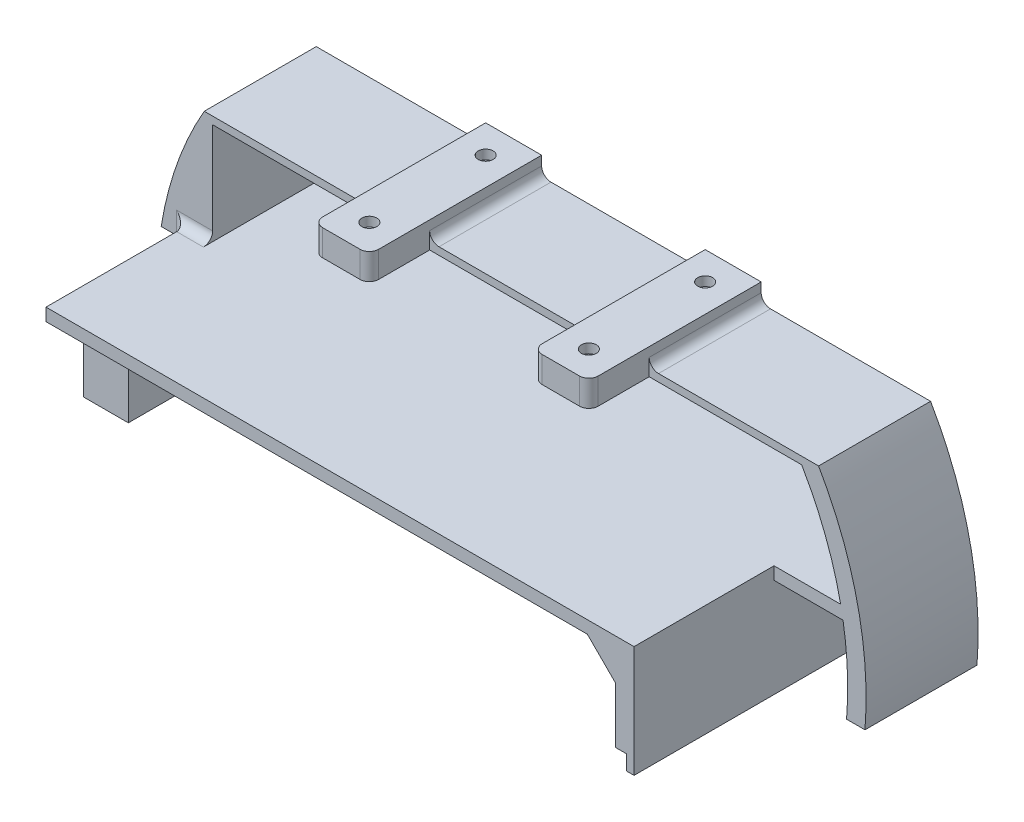
from build123d import *
from build123d.topology import SkipClean

# Parameters (mm, degrees)
BOSS_EXTRUDE1_DEPTH  = 2.54
SKETCH3_W            = 76.962
SKETCH3_H            = 13.7795
CUT_EXTRUDE1_DEPTH   = 55.016072608
BOSS_EXTRUDE2_DEPTH  = 12.7
SKETCH6_W            = 80.01
SKETCH6_H            = 19.05
BOSS_EXTRUDE3_DEPTH  = 1.7145
SKETCH8_W            = 7.62
SKETCH8_H            = 6.35
SKETCH8_W_2          = 2.54
SKETCH8_H_2          = 34.29
BOSS_EXTRUDE4_DEPTH  = 11.43
SKETCH10_W           = 1.016
SKETCH10_H           = 34.29
BOSS_EXTRUDE5_DEPTH  = 2.032
SKETCH13_R           = 0.762
SKETCH13_W           = 7.62
SKETCH13_H           = 23.4442
BOSS_EXTRUDE6_DEPTH  = 2.54
BOSS_EXTRUDE7_START  = -1.016
SKETCH13_2_R         = 0.762
SKETCH13_2_W         = 7.62
SKETCH13_2_H         = 23.4442
BOSS_EXTRUDE7_DEPTH  = 1.016
CUT_EXTRUDE2_REACH   = 68.356
SKETCH13_3_R         = 0.762
SKETCH16_R           = 0.762
CUT_EXTRUDE3_DEPTH   = 8.89
SKETCH17_R           = 1.016
CUT_EXTRUDE4_DEPTH   = 1.27
SKETCH18_R           = 1.016
CUT_EXTRUDE5_DEPTH   = 1.27
BOSS_EXTRUDE8_DEPTH  = 31.75
CUT_EXTRUDE6_REACH   = 104.226
SKETCH20_W           = 15.24
SKETCH20_H           = 2.54
BOSS_EXTRUDE9_DEPTH  = 5.08
BOSS_EXTRUDE10_DEPTH = 12.7
FILLET2_R            = 1.27


with BuildPart() as part:
    # Sketch2 → Boss-Extrude1 (new body)
    with BuildSketch(Plane.XY):
        with BuildLine():
            Line((-41.794385987, 24.13), (41.794385987, 24.13))
            ThreePointArc((41.794385987, 24.13), (47.072627329, 10.639330635), (48.109370189, -3.81))
            Line((48.109370189, -3.81), (-48.109370189, -3.81))
            ThreePointArc((-48.109370189, -3.81), (-47.072627329, 10.639330635), (-41.794385987, 24.13))
        make_face()
    extrude(amount=BOSS_EXTRUDE1_DEPTH)

    # Sketch3 → Cut-Extrude1 (cut, through all)
    with BuildSketch(Plane.XY.offset(2.54)):
        with Locations((-2.164662018, 16.22425)):
            Rectangle(SKETCH3_W, SKETCH3_H)
    extrude(amount=-CUT_EXTRUDE1_DEPTH, mode=Mode.SUBTRACT)

    # Sketch4 → Boss-Extrude2 (add)
    with BuildSketch(Plane.XY.offset(2.54)):
        with BuildLine():
            Line((-22.166164877, 7.62), (47.65462412, 7.62))
            ThreePointArc((47.65462412, 7.62), (45.479955775, 16.143147857), (41.794385987, 24.13))
            Line((41.794385987, 24.13), (-41.794385987, 24.13))
            ThreePointArc((-41.794385987, 24.13), (-45.479955775, 16.143147857), (-47.65462412, 7.62))
            Line((-47.65462412, 7.62), (-22.166164877, 7.62))
        make_face()
        with BuildLine():
            Line((-40.645662018, 23.114), (36.316337982, 23.114))
            Line((36.316337982, 23.114), (39.491337982, 23.114))
            ThreePointArc((39.491337982, 23.114), (42.703177622, 16.439628723), (44.796092255, 9.3345))
            Line((44.796092255, 9.3345), (36.316337982, 9.3345))
            Line((36.316337982, 9.3345), (-40.645662018, 9.3345))
            Line((-40.645662018, 9.3345), (-40.645662018, 23.114))
        make_face(mode=Mode.SUBTRACT)
    extrude(amount=BOSS_EXTRUDE2_DEPTH)

    # Sketch6 → Boss-Extrude3 (add)
    with BuildSketch(Plane.XZ.offset(-7.62)):
        with Locations((-4.27142412, 24.765)):
            Rectangle(SKETCH6_W, SKETCH6_H)
    extrude(amount=-BOSS_EXTRUDE3_DEPTH)

    # Sketch8 → Boss-Extrude4 (add)
    with BuildSketch(Plane.XZ.offset(-7.62)):
        Polygon((-39.45042412, 0), (-39.45042412, 19.05), (-38.18042412, 22.539296323), (-38.18042412, 29.182378244), (-44.27642412, 29.182378244), (-44.27642412, 0), align=None)
        with Locations((3.47557588, 3.175)):
            Rectangle(SKETCH8_W, SKETCH8_H)
        with Locations((34.46357588, 17.145)):
            Rectangle(SKETCH8_W_2, SKETCH8_H_2)
    extrude(amount=BOSS_EXTRUDE4_DEPTH)

    # Sketch10 → Boss-Extrude5 (add)
    with BuildSketch(Plane.XZ.offset(3.81)):
        with Locations((35.22557588, 17.145)):
            Rectangle(SKETCH10_W, SKETCH10_H)
    extrude(amount=BOSS_EXTRUDE5_DEPTH)

    # Sketch13 → Boss-Extrude6 (add)
    # profile 1 of 2: a face of its own
    with BuildSketch(Plane(origin=(0, 24.13, 0), x_dir=(1, 0, 0), z_dir=(0, 1, 0))):
        Polygon((-18.7452, 0), (-11.1252, 0), (-11.1252, -7.62), (-11.1252, -23.4442), (-18.7452, -23.4442), (-18.7452, -7.62), align=None)
        with Locations(Location((-14.9352, -3.81, 0), (0, 0, 270))):
            Circle(SKETCH13_R, mode=Mode.SUBTRACT)
        with Locations(Location((-14.9352, -19.6342, 0), (0, 0, 270))):
            Circle(SKETCH13_R, mode=Mode.SUBTRACT)
    # profile 2 of 2: a face of its own
    with BuildSketch(Plane(origin=(0, 24.13, 0), x_dir=(1, 0, 0), z_dir=(0, 1, 0))):
        with Locations((14.9352, -11.7221)):
            Rectangle(SKETCH13_W, SKETCH13_H)
        with Locations(Location((14.9352, -19.6342, 0), (0, 0, 270))):
            Circle(SKETCH13_R, mode=Mode.SUBTRACT)
        with Locations(Location((14.9352, -3.81, 0), (0, 0, 270))):
            Circle(SKETCH13_R, mode=Mode.SUBTRACT)
    extrude(amount=BOSS_EXTRUDE6_DEPTH)

    # Sketch13<2> → Boss-Extrude7 (add)
    # profile 1 of 2: a face of its own
    with BuildSketch(Plane(origin=(0, 24.13, 0), x_dir=(1, 0, 0), z_dir=(0, 1, 0)).offset(BOSS_EXTRUDE7_START)):
        Polygon((-18.7452, 0), (-11.1252, 0), (-11.1252, -7.62), (-11.1252, -23.4442), (-18.7452, -23.4442), (-18.7452, -7.62), align=None)
        with Locations(Location((-14.9352, -3.81, 0), (0, 0, 270))):
            Circle(SKETCH13_2_R, mode=Mode.SUBTRACT)
        with Locations(Location((-14.9352, -19.6342, 0), (0, 0, 90))):
            Circle(SKETCH13_2_R, mode=Mode.SUBTRACT)
    # profile 2 of 2: a face of its own
    with BuildSketch(Plane(origin=(0, 24.13, 0), x_dir=(1, 0, 0), z_dir=(0, 1, 0)).offset(BOSS_EXTRUDE7_START)):
        with Locations((14.9352, -11.7221)):
            Rectangle(SKETCH13_2_W, SKETCH13_2_H)
        with Locations(Location((14.9352, -19.6342, 0), (0, 0, 90))):
            Circle(SKETCH13_2_R, mode=Mode.SUBTRACT)
        with Locations(Location((14.9352, -3.81, 0), (0, 0, 270))):
            Circle(SKETCH13_2_R, mode=Mode.SUBTRACT)
    extrude(amount=BOSS_EXTRUDE7_DEPTH)

    # Sketch13<3> → Cut-Extrude2 (cut, up to next)
    with BuildSketch(Plane(origin=(0, 24.13, 0), x_dir=(1, 0, 0), z_dir=(0, 1, 0)), mode=Mode.PRIVATE) as cut_extrude2_sk1:
        with Locations(Location((-14.9352, -3.81, 0), (0, 0, 90))):
            Circle(SKETCH13_3_R)
    cut_extrude2_tool1 = extrude(cut_extrude2_sk1.sketch, amount=-CUT_EXTRUDE2_REACH, mode=Mode.PRIVATE) & part.part
    # Sketch13<3> → Cut-Extrude2 (cut, up to next)
    with BuildSketch(Plane(origin=(0, 24.13, 0), x_dir=(1, 0, 0), z_dir=(0, 1, 0)), mode=Mode.PRIVATE) as cut_extrude2_sk2:
        with Locations(Location((14.9352, -3.81, 0), (0, 0, 90))):
            Circle(SKETCH13_3_R)
    cut_extrude2_tool2 = extrude(cut_extrude2_sk2.sketch, amount=-CUT_EXTRUDE2_REACH, mode=Mode.PRIVATE) & part.part
    add(cut_extrude2_tool1.solids().sort_by_distance((-14.9352, 24.13, 3.81))[0], mode=Mode.SUBTRACT)
    add(cut_extrude2_tool2.solids().sort_by_distance((14.9352, 24.13, 3.81))[0], mode=Mode.SUBTRACT)

    # Sketch16 → Cut-Extrude3 (cut)
    with SkipClean():  # the faces are left unmerged after this step: merging them gives an invalid solid
        with BuildSketch(Plane.XZ.offset(3.81)):
            with Locations(Location((-41.31732412, 24.511, 0), (0, 0, 270))):
                Circle(SKETCH16_R)
            with Locations(Location((-41.31732412, 3.429, 0), (0, 0, 270))):
                Circle(SKETCH16_R)
            with Locations(Location((2.62467588, 3.429, 0), (0, 0, 270))):
                Circle(SKETCH16_R)
        extrude(amount=-CUT_EXTRUDE3_DEPTH, mode=Mode.SUBTRACT)

    # Sketch17 → Cut-Extrude4 (cut)
    with SkipClean():  # the faces are left unmerged after this step: merging them gives an invalid solid
        with BuildSketch(Plane.XZ.offset(3.81)):
            with Locations(Location((-41.31732412, 24.511, 0), (0, 0, 270))):
                Circle(SKETCH17_R)
            with Locations(Location((-41.31732412, 3.429, 0), (0, 0, 270))):
                Circle(SKETCH17_R)
            with Locations(Location((2.62467588, 3.429, 0), (0, 0, 270))):
                Circle(SKETCH17_R)
        extrude(amount=-CUT_EXTRUDE4_DEPTH, mode=Mode.SUBTRACT)

    # Sketch18 → Cut-Extrude5 (cut)
    with BuildSketch(Plane(origin=(0, 26.67, 0), x_dir=(1, 0, 0), z_dir=(0, 1, 0))):
        with Locations(Location((-14.9352, -3.81, 0), (0, 0, 270))):
            Circle(SKETCH18_R)
        with Locations(Location((14.9352, -19.6342, 0), (0, 0, 270))):
            Circle(SKETCH18_R)
        with Locations(Location((-14.9352, -19.6342, 0), (0, 0, 270))):
            Circle(SKETCH18_R)
        with Locations(Location((14.9352, -3.81, 0), (0, 0, 270))):
            Circle(SKETCH18_R)
    extrude(amount=-CUT_EXTRUDE5_DEPTH, mode=Mode.SUBTRACT)

    # Sketch19 → Boss-Extrude8 (add)
    with BuildSketch(Plane.XY.offset(2.54)):
        Polygon((33.19357588, 7.62), (33.19357588, 3.81), (29.38357588, 7.62), align=None)
    extrude(amount=BOSS_EXTRUDE8_DEPTH)

    # Sketch20 → Cut-Extrude6 (cut, up to next)
    with BuildSketch(Plane.ZY.offset(44.27642412), mode=Mode.PRIVATE) as cut_extrude6_sk1:
        with Locations((15.24, 6.35)):
            Rectangle(SKETCH20_W, SKETCH20_H)
    cut_extrude6_tool1 = extrude(cut_extrude6_sk1.sketch, amount=-CUT_EXTRUDE6_REACH, mode=Mode.PRIVATE) & part.part
    add(cut_extrude6_tool1.solids().sort_by_distance((-44.276424, 6.35, 15.24))[0], mode=Mode.SUBTRACT)

    # Sketch21 → Boss-Extrude9 (add)
    with BuildSketch(Plane.XY.offset(2.54)):
        with BuildLine():
            Line((-48.109370189, -3.81), (-44.27642412, -3.81))
            Line((-44.27642412, -3.81), (-44.27642412, 7.62))
            Line((-44.27642412, 7.62), (-47.65462412, 7.62))
            ThreePointArc((-47.65462412, 7.62), (-48.221850613, 1.918521174), (-48.109370189, -3.81))
        make_face()
    extrude(amount=BOSS_EXTRUDE9_DEPTH)

    # Sketch21<3> → Boss-Extrude10 (add)
    with BuildSketch(Plane.XY.offset(2.54)):
        with BuildLine():
            Line((44.796092255, 9.3345), (47.65462412, 7.62))
            ThreePointArc((47.65462412, 7.62), (48.221850613, 1.918521174), (48.109370189, -3.81))
            Line((48.109370189, -3.81), (45.599415255, -3.81))
            ThreePointArc((45.599415255, -3.81), (45.673092895, 2.791300239), (44.796092255, 9.3345))
        make_face()
    extrude(amount=BOSS_EXTRUDE10_DEPTH)

    # Fillet2
    fillet2_edges = [part.edges().sort_by_distance(p)[0] for p in [
        (18.7452, 24.13, 7.62),
        (11.1252, 24.13, 7.62),
        (-11.1252, 24.13, 7.62),
        (-18.7452, 24.13, 7.62),
        (-18.7452, 24.892, 23.4442),
        (-11.1252, 24.892, 23.4442),
        (18.7452, 24.892, 23.4442),
        (11.1252, 24.892, 23.4442),
        (37.903837982, 23.114, 2.54),
        (42.703177622, 16.439628723, 2.54),
        (40.556215118, 9.3345, 2.54),
        (35.73357588, 1.905, 2.54),
        (40.426477497, 7.62, 2.54),
        (45.718006714, 1.920060852, 2.54),
        (7.28557588, 1.905, 2.54),
        (7.28557588, 1.905, 6.35),
        (-0.33442412, 1.905, 6.35),
        (-0.33442412, 1.905, 2.54),
        (-41.22842412, 7.62, 29.182378244),
        (-38.18042412, 7.62, 26.021189122),
        (-39.45042412, 1.905, 2.54),
        (-44.27642412, 0.635, 7.62),
        (-42.461043069, 9.3345, 15.24),
        (-44.27642412, 8.47725, 15.24),
        (-41.22842412, 5.08, 22.86),
        (-41.22842412, 7.62, 22.86),
        (-41.86342412, 5.08, 7.62),
        (-43.55252412, 7.62, 7.62),
    ]]
    fillet(fillet2_edges, radius=FILLET2_R - 0.0001)  # a hair under: the kernel refuses the full size


solid = part.part
